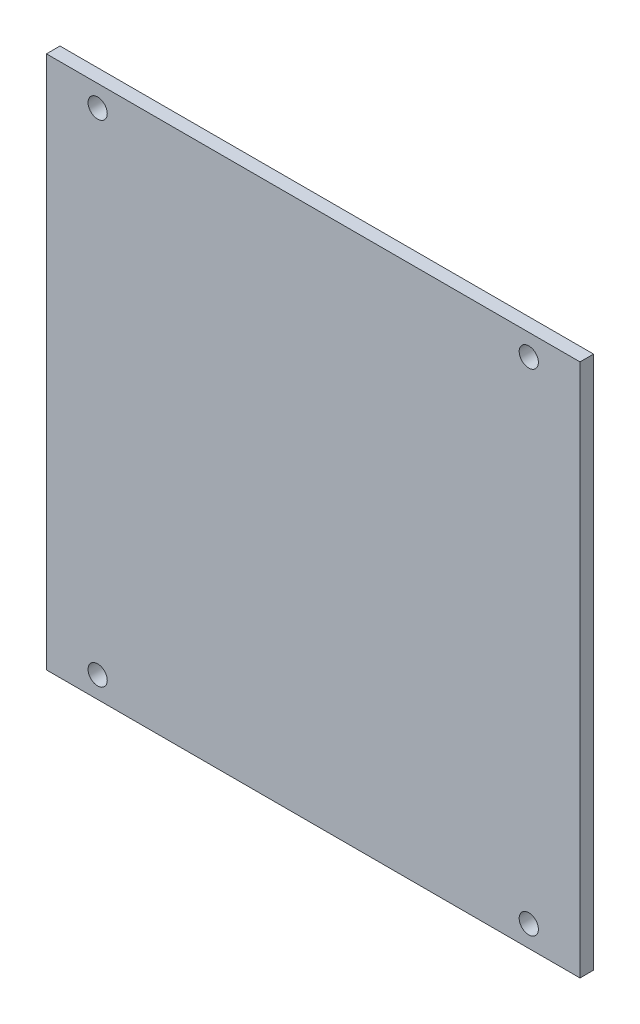
from build123d import *

# Parameters (mm, degrees)
SKETCH1_W           = 125
SKETCH1_H           = 125
BOSS_EXTRUDE1_DEPTH = 3.175
SKETCH2_R           = 2.25
CUT_EXTRUDE2_DEPTH  = 3.175


with BuildPart() as part:
    # Sketch1 → Boss-Extrude1 (new body)
    with BuildSketch(Plane.XY):
        Rectangle(SKETCH1_W, SKETCH1_H)
    extrude(amount=BOSS_EXTRUDE1_DEPTH)

    # Sketch2 → Cut-Extrude2 (cut)
    with BuildSketch(Plane.XY.offset(3.175)):
        with Locations((-50.5, 57.5)):
            Circle(SKETCH2_R)
        with Locations((-50.5, -57.5)):
            Circle(SKETCH2_R)
        with Locations((50.5, -57.5)):
            Circle(SKETCH2_R)
        with Locations((50.5, 57.5)):
            Circle(SKETCH2_R)
    extrude(amount=-CUT_EXTRUDE2_DEPTH, mode=Mode.SUBTRACT)


solid = part.part
